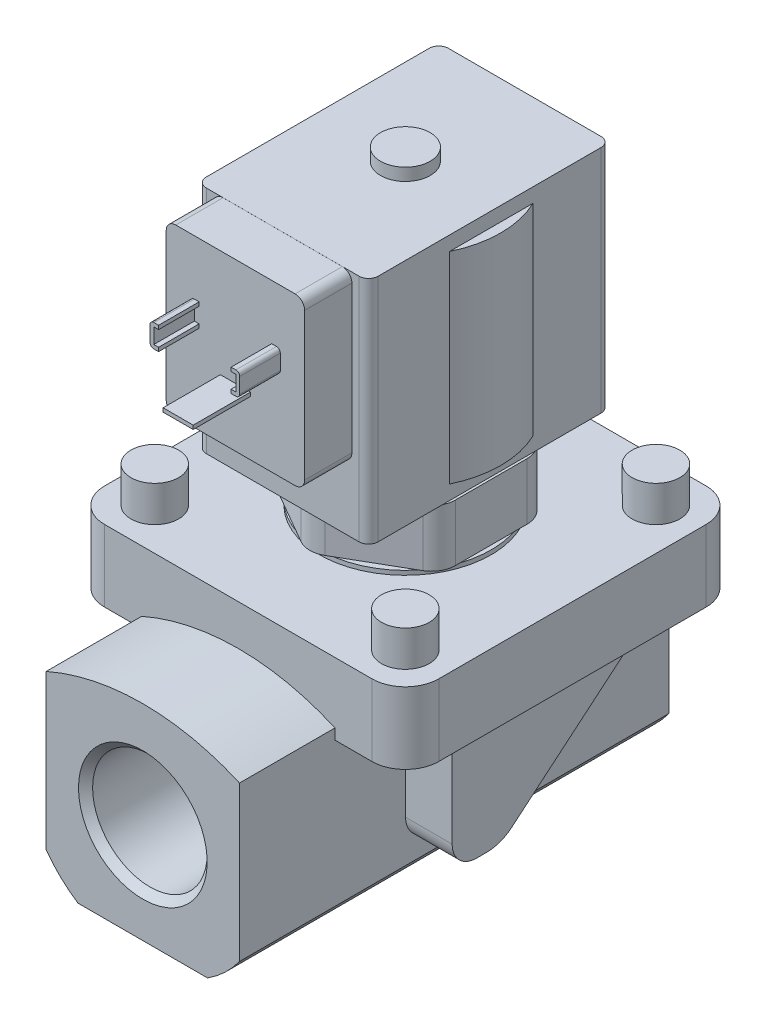
from build123d import *

# Parameters (mm, degrees)
IZIM1_W                      = 50.7
IZIM1_H                      = 48.2
Y_KSEKLIK_EKSTR_ZYON1_DEPTH  = 26.7
IZIM2_R                      = 8.7
Y_KSEKLIK_EKSTR_ZYON2_DEPTH  = 0.5
Y_KSEKLIK_EKSTR_ZYON3_DEPTH  = 11.9
IZIM4_R                      = 16.5
Y_KSEKLIK_EKSTR_ZYON4_DEPTH  = 0.9
IZIM5_R                      = 18
Y_KSEKLIK_EKSTR_ZYON5_DEPTH  = 0.9
Y_KSEKLIK_EKSTR_ZYON6_DEPTH  = 36
Y_KSEKLIK_EKSTR_ZYON7_DEPTH  = 17
Y_KSEKLIK_EKSTR_ZYON8_START  = 17
Y_KSEKLIK_EKSTR_ZYON8_DEPTH  = 17
IZIM9_W                      = 14.75
IZIM9_H                      = 70
KES_EKSTR_ZYON1_DEPTH        = 30.160746911
IZIM10_W                     = 14.75
IZIM10_H                     = 70
KES_EKSTR_ZYON2_DEPTH        = 30.160746911
IZIM11_W                     = 50.7
IZIM11_H                     = 48.2
Y_KSEKLIK_EKSTR_ZYON9_DEPTH  = 9.3
Y_KSEKLIK_EKSTR_ZYON10_START = 20
Y_KSEKLIK_EKSTR_ZYON10_DEPTH = 20
IZIM13_W                     = 9.75
IZIM13_H                     = 10.2
Y_KSEKLIK_EKSTR_ZYON11_DEPTH = 26.5
Y_KSEKLIK_EKSTR_ZYON12_DEPTH = 42.2
Y_KSEKLIK_EKSTR_ZYON13_START = -42.2
Y_KSEKLIK_EKSTR_ZYON13_DEPTH = 42.2
IZIM16_W                     = 29
IZIM16_H                     = 34.79
Y_KSEKLIK_EKSTR_ZYON14_DEPTH = 9.9
Y_KSEKLIK_EKSTR_ZYON15_DEPTH = 8.5
Y_KSEKLIK_EKSTR_ZYON16_DEPTH = 8.5
IZIM19_W                     = 6.3
IZIM19_H                     = 0.8
Y_KSEKLIK_EKSTR_ZYON17_DEPTH = 12
DRAFT1_ANGLE                 = 50
IZIM20_W                     = 5
IZIM20_H                     = 7.5
IZIM21_W                     = 5
IZIM21_H                     = 7.5
IZIM22_W                     = 5
IZIM22_H                     = 7.5
IZIM23_W                     = 5
IZIM23_H                     = 7.5
IZIM24_W                     = 5.2
IZIM24_H                     = 2.6
M20_BO_LUKLU_DELIK1_D        = 24
M20_BO_LUKLU_DELIK1_DEPTH    = 33.25
M27_BO_LUKLU_DELIK2_D        = 30.291
M27_BO_LUKLU_DELIK2_DEPTH    = 33.249
FEDER1_START                 = -30
FEDER1_DEPTH                 = 9.75
PAH1_SIZE                    = 1.479
RADYUS1_R                    = 0.8
RADYUS2_R                    = 2
RADYUS3_R                    = 5
RADYUS4_R                    = 5.1
RADYUS5_R                    = 7
RADYUS6_R                    = 8.16
L_EK1_SCALE                  = 0.31


# Read off the part's stored shape, not the designer's step: Feder1
with BuildPart() as part:
    # Çizim1 → Yükseklik-Ekstrüzyon1 (new body)
    with BuildSketch(Plane(origin=(18, 0, 0), x_dir=(0, 0, -1), z_dir=(1, 0, 0))):
        with Locations((-0.35, 68.8)):
            Rectangle(IZIM1_W, IZIM1_H)
    extrude(amount=-Y_KSEKLIK_EKSTR_ZYON1_DEPTH)

    # Çizim2 → Yükseklik-Ekstrüzyon2 (add)
    with BuildSketch(Plane.XZ.offset(-44.7)):
        with Locations(Location((0, 0, 0), (0, 0, 180))):
            Circle(IZIM2_R)
    extrude(amount=Y_KSEKLIK_EKSTR_ZYON2_DEPTH)

    # Çizim3 → Yükseklik-Ekstrüzyon3 (add)
    with BuildSketch(Plane(origin=(0, 44.2, 0), x_dir=(1, 0, 0), z_dir=(0, 1, 0))):
        Polygon((-18, 10.392304845), (-18, -10.392304845), (0, -20.784609691), (18, -10.392304845), (18, 10.392304845), (0, 20.784609691), align=None)
    extrude(amount=-Y_KSEKLIK_EKSTR_ZYON3_DEPTH)

    # Çizim4 → Yükseklik-Ekstrüzyon4 (add)
    with BuildSketch(Plane.XZ.offset(-32.3)):
        with Locations(Location((0, 0, 0), (0, 0, 270))):
            Circle(IZIM4_R)
    extrude(amount=Y_KSEKLIK_EKSTR_ZYON4_DEPTH)

    # Çizim5 → Yükseklik-Ekstrüzyon5 (add)
    with BuildSketch(Plane(origin=(0, 31.4, 0), x_dir=(1, 0, 0), z_dir=(0, 1, 0))):
        with Locations(Location((0, 0, 0), (0, 0, 90))):
            Circle(IZIM5_R)
    extrude(amount=-Y_KSEKLIK_EKSTR_ZYON5_DEPTH)

    # Çizim6 → Yükseklik-Ekstrüzyon6 (add)
    with BuildSketch(Plane.XY.offset(18)):
        with BuildLine():
            Line((-13.564659966, -21), (13.564659966, -21))
            ThreePointArc((13.564659966, -21), (17.201870235, -18.14099392), (20.25, -14.660746911))
            Line((20.25, -14.660746911), (35, -14.660746911))
            Line((35, -14.660746911), (35, 30.5))
            Line((35, 30.5), (0, 30.5))
            Line((0, 30.5), (-35, 30.5))
            Line((-35, 30.5), (-35, -14.660746911))
            Line((-35, -14.660746911), (-20.25, -14.660746911))
            ThreePointArc((-20.25, -14.660746911), (-17.201870235, -18.14099392), (-13.564659966, -21))
        make_face()
    extrude(amount=-Y_KSEKLIK_EKSTR_ZYON6_DEPTH)

    # Çizim7 → Yükseklik-Ekstrüzyon7 (add)
    with BuildSketch(Plane(origin=(0, 0, -18), x_dir=(-1, 0, 0), z_dir=(0, 0, -1))):
        with BuildLine():
            Line((13.564659966, -21), (-13.564659966, -21))
            ThreePointArc((-13.564659966, -21), (-17.201870235, -18.14099392), (-20.25, -14.660746911))
            Line((-20.25, -14.660746911), (-35, -14.660746911))
            Line((-35, -14.660746911), (-35, 30.5))
            Line((-35, 30.5), (35, 30.5))
            Line((35, 30.5), (35, -14.660746911))
            Line((35, -14.660746911), (20.25, -14.660746911))
            ThreePointArc((20.25, -14.660746911), (17.201870235, -18.14099392), (13.564659966, -21))
        make_face()
    extrude(amount=Y_KSEKLIK_EKSTR_ZYON7_DEPTH)

    # Çizim8 → Yükseklik-Ekstrüzyon8 (add)
    with BuildSketch(Plane.XY.offset(18).offset(Y_KSEKLIK_EKSTR_ZYON8_START)):
        with BuildLine():
            Line((13.564659966, -21), (-13.564659966, -21))
            ThreePointArc((-13.564659966, -21), (-17.201870235, -18.14099392), (-20.25, -14.660746911))
            Line((-20.25, -14.660746911), (-35, -14.660746911))
            Line((-35, -14.660746911), (-35, 30.5))
            Line((-35, 30.5), (35, 30.5))
            Line((35, 30.5), (35, -14.660746911))
            Line((35, -14.660746911), (20.25, -14.660746911))
            ThreePointArc((20.25, -14.660746911), (17.201870235, -18.14099392), (13.564659966, -21))
        make_face()
    extrude(amount=-Y_KSEKLIK_EKSTR_ZYON8_DEPTH)

    # Çizim9 → Kes-Ekstrüzyon1 (cut)
    with BuildSketch(Plane.XZ.offset(14.660746911)):
        with Locations((27.625, 0)):
            Rectangle(IZIM9_W, IZIM9_H)
    extrude(amount=-KES_EKSTR_ZYON1_DEPTH, mode=Mode.SUBTRACT)

    # Çizim10 → Kes-Ekstrüzyon2 (cut)
    with BuildSketch(Plane.XZ.offset(14.660746911)):
        with Locations((-27.625, 0)):
            Rectangle(IZIM10_W, IZIM10_H)
    extrude(amount=-KES_EKSTR_ZYON2_DEPTH, mode=Mode.SUBTRACT)

    # Çizim11 → Yükseklik-Ekstrüzyon9 (add)
    with BuildSketch(Plane.ZY.offset(8.7)):
        with Locations((0.35, 68.8)):
            Rectangle(IZIM11_W, IZIM11_H)
    extrude(amount=Y_KSEKLIK_EKSTR_ZYON9_DEPTH)

    # Çizim12 → Yükseklik-Ekstrüzyon10 (add)
    with BuildSketch(Plane.XY.offset(35).offset(Y_KSEKLIK_EKSTR_ZYON10_START)):
        with BuildLine():
            Line((-20.25, -14.660746911), (-20.25, 17.715834237))
            ThreePointArc((-20.25, 17.715834237), (0, 22), (20.25, 17.715834237))
            Line((20.25, 17.715834237), (20.25, -14.660746911))
            ThreePointArc((20.25, -14.660746911), (17.201870235, -18.14099392), (13.564659966, -21))
            Line((13.564659966, -21), (-13.564659966, -21))
            ThreePointArc((-13.564659966, -21), (-17.201870235, -18.14099392), (-20.25, -14.660746911))
        make_face()
    extrude(amount=-Y_KSEKLIK_EKSTR_ZYON10_DEPTH)

    # Çizim13 → Yükseklik-Ekstrüzyon11 (add)
    with BuildSketch(Plane.XZ.offset(-15.5)):
        with Locations((25.125, 15.1)):
            Rectangle(IZIM13_W, IZIM13_H)
    extrude(amount=Y_KSEKLIK_EKSTR_ZYON11_DEPTH)

    # Çizim14 → Yükseklik-Ekstrüzyon12 (add)
    with BuildSketch(Plane(origin=(0, 89.9, 0), x_dir=(1, 0, 0), z_dir=(0, 1, 0))):
        with BuildLine():
            Line((-18, -8.717797887), (-18, 8.717797887))
            ThreePointArc((-18, 8.717797887), (-20, 0), (-18, -8.717797887))
        make_face()
    extrude(amount=-Y_KSEKLIK_EKSTR_ZYON12_DEPTH)

    # Çizim15 → Yükseklik-Ekstrüzyon13 (add)
    with BuildSketch(Plane.XZ.offset(-47.7).offset(Y_KSEKLIK_EKSTR_ZYON13_START)):
        with BuildLine():
            Line((18, 8.717797887), (18, -8.717797887))
            ThreePointArc((18, -8.717797887), (20, 0), (18, 8.717797887))
        make_face()
    extrude(amount=Y_KSEKLIK_EKSTR_ZYON13_DEPTH)

    # Çizim16 → Yükseklik-Ekstrüzyon14 (add)
    with BuildSketch(Plane.XY.offset(25.7)):
        with Locations((0, 75.495)):
            Rectangle(IZIM16_W, IZIM16_H)
    extrude(amount=Y_KSEKLIK_EKSTR_ZYON14_DEPTH)

    # Çizim17 → Yükseklik-Ekstrüzyon15 (add)
    with BuildSketch(Plane.XY.offset(35.6)):
        Polygon((-9.4, 81.4), (-7.6, 81.4), (-7.6, 80.6), (-8.6, 80.6), (-8.6, 77.4), (-7.6, 77.4), (-7.6, 76.6), (-9.4, 76.6), align=None)
    extrude(amount=Y_KSEKLIK_EKSTR_ZYON15_DEPTH)

    # Çizim18 → Yükseklik-Ekstrüzyon16 (add)
    with BuildSketch(Plane.XY.offset(35.6)):
        Polygon((7.6, 77.4), (8.6, 77.4), (8.6, 80.6), (7.6, 80.6), (7.6, 81.4), (9.4, 81.4), (9.4, 76.6), (7.6, 76.6), align=None)
    extrude(amount=Y_KSEKLIK_EKSTR_ZYON16_DEPTH)

    # Çizim19 → Yükseklik-Ekstrüzyon17 (add)
    with BuildSketch(Plane.XY.offset(35.6)):
        with Locations((0, 70)):
            Rectangle(IZIM19_W, IZIM19_H)
    extrude(amount=Y_KSEKLIK_EKSTR_ZYON17_DEPTH)

    # Draft1
    draft1_faces = [part.faces().sort_by_distance(p)[0] for p in [
        (25.125, 2.25, 10),
    ]]
    draft(draft1_faces, Plane(origin=(0, -11, 0), x_dir=(0, 0, -1), z_dir=(0, -1, 0)), DRAFT1_ANGLE)

    # Çizim20 → Döndür1 (revolve)
    with BuildSketch(Plane.XY.offset(26.25), mode=Mode.PRIVATE) as d_nd_r1_sk:
        with Locations((-23.75, 34.25)):
            Rectangle(IZIM20_W, IZIM20_H)
    revolve(d_nd_r1_sk.sketch.rotate(Axis((-26.25, 38, 26.25), (0, -1, 0)), 270), axis=Axis((-26.25, 38, 26.25), (0, -1, 0)))

    # Çizim21 → Döndür2 (revolve)
    with BuildSketch(Plane.XY.offset(-26.25), mode=Mode.PRIVATE) as d_nd_r2_sk:
        with Locations((-23.75, 34.25)):
            Rectangle(IZIM21_W, IZIM21_H)
    revolve(d_nd_r2_sk.sketch.rotate(Axis((-26.25, 38, -26.25), (0, -1, 0)), 270), axis=Axis((-26.25, 38, -26.25), (0, -1, 0)))

    # Çizim22 → Döndür3 (revolve)
    with BuildSketch(Plane.XY.offset(-26.25), mode=Mode.PRIVATE) as d_nd_r3_sk:
        with Locations((28.75, 34.25)):
            Rectangle(IZIM22_W, IZIM22_H)
    revolve(d_nd_r3_sk.sketch.rotate(Axis((26.25, 38, -26.25), (0, -1, 0)), 270), axis=Axis((26.25, 38, -26.25), (0, -1, 0)))

    # Çizim23 → Döndür4 (revolve)
    with BuildSketch(Plane.XY.offset(26.25), mode=Mode.PRIVATE) as d_nd_r4_sk:
        with Locations((28.75, 34.25)):
            Rectangle(IZIM23_W, IZIM23_H)
    revolve(d_nd_r4_sk.sketch.rotate(Axis((26.25, 38, 26.25), (0, -1, 0)), 270), axis=Axis((26.25, 38, 26.25), (0, -1, 0)))

    # Çizim24 → Döndür5 (revolve)
    with BuildSketch(Plane(origin=(0, 0, 0), x_dir=(-1, 0, 0), z_dir=(0, 0, -1)), mode=Mode.PRIVATE) as d_nd_r5_sk:
        with Locations((-2.6, 94.2)):
            Rectangle(IZIM24_W, IZIM24_H)
    revolve(d_nd_r5_sk.sketch.rotate(Axis((0, 92.9, 0), (0, 1, 0)), 90), axis=Axis((0, 92.9, 0), (0, 1, 0)))

    # M20 Boşluklu Delik1
    with Locations(Plane.XY.offset(55)):
        with Locations((0, 0)):
            Hole(M20_BO_LUKLU_DELIK1_D / 2, depth=M20_BO_LUKLU_DELIK1_DEPTH)

    # M27 Boşluklu Delik2
    with Locations(Plane(origin=(0, 0, -35), x_dir=(-1, 0, 0), z_dir=(0, 0, -1))):
        with Locations((0, 0)):
            Hole(M27_BO_LUKLU_DELIK2_D / 2, depth=M27_BO_LUKLU_DELIK2_DEPTH)

    # Feder1 outline → Feder1 (add)
    with BuildSketch(Plane.YZ.offset(FEDER1_START)):
        Polygon((15.5, 19.826070485), (-9.313312955, 19.826070485), (-12.686687045, 12.591846402), (15.5, -20.999739147), align=None)
    extrude(amount=FEDER1_DEPTH)

    # Pah1
    pah1_edges = [part.edges().sort_by_distance(p)[0] for p in [
        (12, 0, 55),
        (-15.1455, 0, -35),
    ]]
    chamfer(pah1_edges, length=PAH1_SIZE)

    # Radyus1
    radyus1_edges = [part.edges().sort_by_distance(p)[0] for p in [
        (-9.4, 81.4, 39.85),
        (-9.4, 76.6, 39.85),
        (9.4, 76.6, 39.85),
        (9.4, 81.4, 39.85),
    ]]
    fillet(radyus1_edges, radius=RADYUS1_R)

    # Radyus2
    radyus2_edges = [part.edges().sort_by_distance(p)[0] for p in [
        (-18, 68.8, -25),
        (-18, 68.8, 25.7),
        (-14.5, 92.89, 30.65),
        (-14.5, 58.1, 30.65),
        (14.5, 58.1, 30.65),
        (14.5, 92.89, 30.65),
        (18, 68.8, 25.7),
        (18, 68.8, -25),
    ]]
    fillet(radyus2_edges, radius=RADYUS2_R)

    # Radyus3
    radyus3_edges = [part.edges().sort_by_distance(p)[0] for p in [
        (-18, 38.25, -10.392304845),
        (0, 38.25, -20.784609691),
        (18, 38.25, -10.392304845),
        (18, 38.25, 10.392304845),
        (0, 38.25, 20.784609691),
        (-18, 38.25, 10.392304845),
    ]]
    fillet(radyus3_edges, radius=RADYUS3_R)

    # Radyus4
    radyus4_edges = [part.edges().sort_by_distance(p)[0] for p in [
        (25.125, -11, 20.2),
    ]]
    fillet(radyus4_edges, radius=RADYUS4_R)

    # Radyus5
    radyus5_edges = [part.edges().sort_by_distance(p)[0] for p in [
        (35, 23, 35),
        (-35, 23, -35),
        (35, 23, -35),
        (-35, 23, 35),
    ]]
    fillet(radyus5_edges, radius=RADYUS5_R)

    # Radyus6
    radyus6_edges = [part.edges().sort_by_distance(p)[0] for p in [
        (25.125, -11, 10),
    ]]
    fillet(radyus6_edges, radius=RADYUS6_R)


with BuildPart() as part_1:
    # Ölçek1: scaled about (0.014012089, 30.59302606, 5.902020233)
    add(part.part.scale(L_EK1_SCALE).moved(Location((0.009668341, 21.109187981, 4.072393961))))


solid = part_1.part
